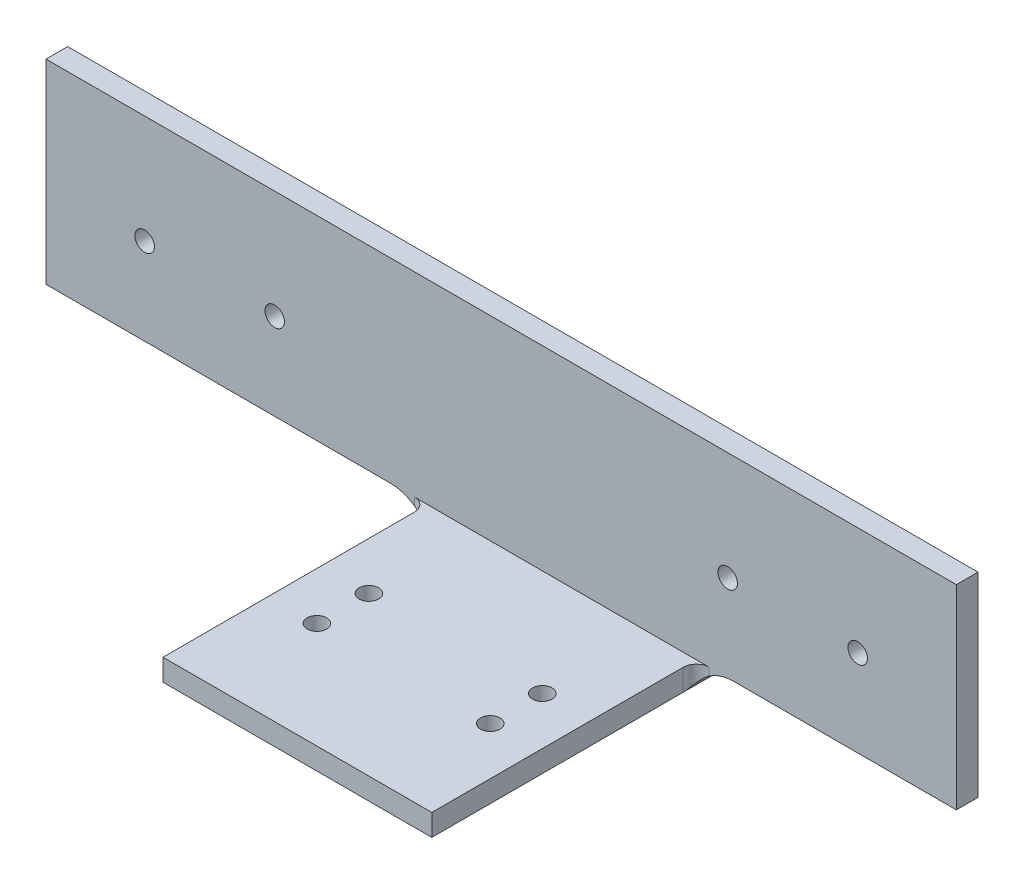
from build123d import *

# Parameters (mm, degrees)
SKETCH_1_W          = 210
SKETCH_1_H          = 50
EXTRUDE_1_DEPTH     = 5
SKETCH_3_R          = 2.25
CUT_EXTRUDE_1_DEPTH = 5
SKETCH_4_W          = 210
SKETCH_4_H          = 5
EXTRUDE_2_DEPTH     = 61
CUT_EXTRUDE_2_REACH = 227.734
SKETCH_6_W          = 60
SKETCH_6_H          = 5
FILLET_1_R          = 10
CUT_EXTRUDE_3_REACH = 227.734
SKETCH_7_W          = 88
SKETCH_7_H          = 5
FILLET_2_R          = 10
FILLET_6_R          = 3
SKETCH_11_R         = 2.25
CUT_EXTRUDE_4_DEPTH = 225.67977212


with BuildPart() as part:
    # 草图1 → 凸台-拉伸1 (new body)
    with BuildSketch(Plane.XY):
        with Locations((105, 25)):
            Rectangle(SKETCH_1_W, SKETCH_1_H)
    extrude(amount=EXTRUDE_1_DEPTH)

    # 草图3 → 切除-拉伸1 (cut)
    with BuildSketch(Plane.XY.offset(5)):
        with Locations((157.25, 25)):
            Circle(SKETCH_3_R)
        with Locations((187.25, 25)):
            Circle(SKETCH_3_R)
        with Locations(Location((22.75, 25, 0), (0, 0, 180))):
            Circle(SKETCH_3_R)
        with Locations(Location((52.75, 25, 0), (0, 0, 180))):
            Circle(SKETCH_3_R)
    extrude(amount=-CUT_EXTRUDE_1_DEPTH, mode=Mode.SUBTRACT)

    # 草图4 → 凸台-拉伸2 (add)
    with BuildSketch(Plane.XY.offset(5)):
        with Locations((105, 2.5)):
            Rectangle(SKETCH_4_W, SKETCH_4_H)
    extrude(amount=EXTRUDE_2_DEPTH)

    # 草图6 → 切除-拉伸2 (cut, up to next)
    with BuildSketch(Plane.XY.offset(66), mode=Mode.PRIVATE) as cut_extrude_2_sk1:
        with Locations((180, 2.5)):
            Rectangle(SKETCH_6_W, SKETCH_6_H)
    cut_extrude_2_tool1 = extrude(cut_extrude_2_sk1.sketch, amount=-CUT_EXTRUDE_2_REACH, mode=Mode.PRIVATE) & part.part
    add(cut_extrude_2_tool1.solids().sort_by_distance((180, 2.5, 66))[0], mode=Mode.SUBTRACT)

    # 圆角1
    # the kernel refuses this fillet: 10 mm, written as the material it adds along each edge
    with BuildSketch(Plane(origin=(150, 5, 0), x_dir=(0, -1, 0), z_dir=(0, 0, 1))) as fillet_1_piece_1:
        with BuildLine():
            CenterArc((10, 8.660254038), FILLET_1_R, 180, 60)
            Line((0, 8.660254038), (0, 0))
            Line((0, 0), (5, 0))
        make_face()
    extrude(amount=5)

    # 草图7 → 切除-拉伸3 (cut, up to next)
    with BuildSketch(Plane.XY.offset(66), mode=Mode.PRIVATE) as cut_extrude_3_sk1:
        with Locations((44, 2.5)):
            Rectangle(SKETCH_7_W, SKETCH_7_H)
    cut_extrude_3_tool1 = extrude(cut_extrude_3_sk1.sketch, amount=-CUT_EXTRUDE_3_REACH, mode=Mode.PRIVATE) & part.part
    add(cut_extrude_3_tool1.solids().sort_by_distance((44, 2.5, 66))[0], mode=Mode.SUBTRACT)

    # 圆角2
    # the kernel refuses this fillet: 10 mm, written as the material it adds along each edge
    with BuildSketch(Plane(origin=(88, 5, 0), x_dir=(0, -1, 0), z_dir=(0, 0, 1))) as fillet_2_piece_1:
        with BuildLine():
            CenterArc((10, -8.660254038), FILLET_2_R, 120, 60)
            Line((0, -8.660254038), (0, 0))
            Line((0, 0), (5, 0))
        make_face()
    extrude(amount=5)

    # 圆角6
    # the kernel refuses this fillet: 3 mm, written as the material it adds along each edge
    with BuildSketch(Plane(origin=(150, 5, 5), x_dir=(1, 0, 0), z_dir=(0, -1, 0))) as fillet_6_piece_1_section:
        with BuildLine():
            CenterArc((FILLET_6_R, FILLET_6_R), FILLET_6_R, 180, 90)
            Line((0, FILLET_6_R), (0, 0))
            Line((0, 0), (FILLET_6_R, 0))
        make_face()
    fillet_6_piece_1 = extrude(amount=5, mode=Mode.PRIVATE)
    fillet_6_piece_1 = fillet_6_piece_1 - Plane(origin=(158.660254038, -5, 5.756133445), x_dir=(0, -1, 0), z_dir=(0, 0, -1)) * Cylinder(10, 22, mode=Mode.PRIVATE)
    add(fillet_6_piece_1)
    with BuildSketch(Plane(origin=(88, 5, 5), x_dir=(-1, 0, 0), z_dir=(0, -1, 0))) as fillet_6_piece_2_section:
        with BuildLine():
            CenterArc((FILLET_6_R, -FILLET_6_R), FILLET_6_R, 90, 90)
            Line((0, -FILLET_6_R), (0, 0))
            Line((0, 0), (FILLET_6_R, 0))
        make_face()
    fillet_6_piece_2 = extrude(amount=5, mode=Mode.PRIVATE)
    fillet_6_piece_2 = fillet_6_piece_2 - Plane(origin=(79.339745962, -5, 5.756136784), x_dir=(0, -1, 0), z_dir=(0, 0, -1)) * Cylinder(10, 22, mode=Mode.PRIVATE)
    add(fillet_6_piece_2)

    # 草图11 → 切除-拉伸4 (cut, through all)
    with BuildSketch(Plane(origin=(0, 5, 0), x_dir=(1, 0, 0), z_dir=(0, 1, 0))):
        with Locations(Location((98.991167509, -29.5, 0), (0, 0, 180))):
            Circle(SKETCH_11_R)
        with Locations(Location((138.991167509, -29.5, 0), (0, 0, 180))):
            Circle(SKETCH_11_R)
        with Locations(Location((98.991167509, -41.5, 0), (0, 0, 180))):
            Circle(SKETCH_11_R)
        with Locations(Location((138.991167509, -41.5, 0), (0, 0, 180))):
            Circle(SKETCH_11_R)
    extrude(amount=-CUT_EXTRUDE_4_DEPTH, mode=Mode.SUBTRACT)


solid = part.part
